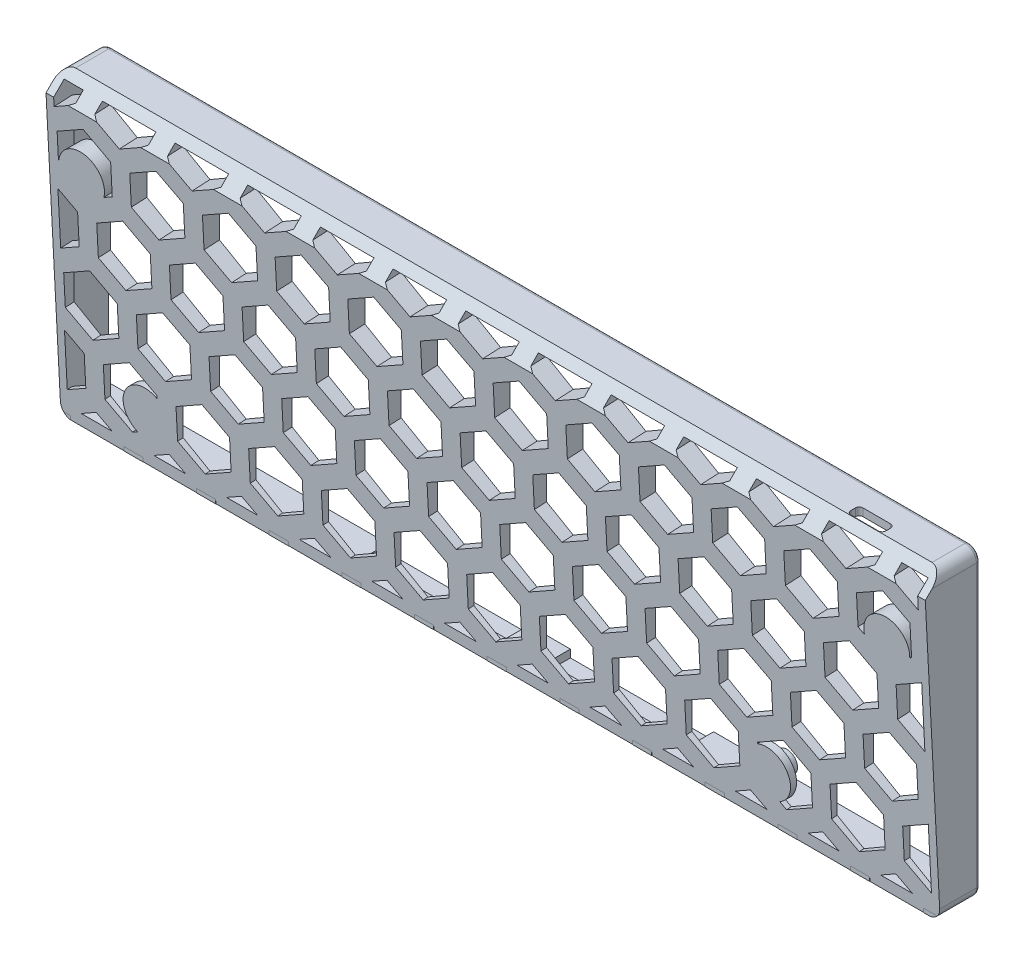
from build123d import *

# Parameters (mm, degrees)
EXTRUDE_START               = -317.833629667
EXTRUDE_5_DEPTH             = 229.901447803
SKETCH_8_R                  = 2.75
SKETCH_8_R_2                = 2.1
EXTRUDE_6_DEPTH             = 3.5
SKETCH_9_W                  = 229.901447803
SKETCH_9_H                  = 78.517145035
SKETCH_9_W_2                = 225.901447803
SKETCH_9_H_2                = 74.517145035
EXTRUDE_7_DEPTH             = 9.5
CUT_EXTRUDE_1_REACH         = 329.028
SKETCH_10_W                 = 9.2
SKETCH_10_H                 = 3.2
CUT_EXTRUDE_2_REACH         = 329.502
SKETCH_11_W                 = 37.443098272
SKETCH_11_H                 = 6
SKETCH_11_W_2               = 36.905977084
SKETCH_16_W                 = 229.901447803
SKETCH_16_H                 = 10.501372346
EXTRUDE_11_DEPTH            = 1
FILLET_3_R                  = 1
CUT_EXTRUDE_4_REACH         = 361.437
PATTERN_LINEAR_4_COUNT      = 7
PATTERN_LINEAR_4_PITCH      = 38
PATTERN_LINEAR_4_COUNT_DIR2 = 3
PATTERN_LINEAR_4_PITCH_DIR2 = 33
EXTRUDE_10_REACH            = 361.371
SKETCH_15_W                 = 229.901447803
SKETCH_15_H                 = 79.517145035
SKETCH_15_W_2               = 225.901447803
SKETCH_15_H_2               = 74.517145035
SKETCH_15_R                 = 6
CHAMFER_1_SIZE              = 5
CHAMFER_1_SIZE_2            = 4.75753014
FILLET_4_R                  = 3
FILLET_5_R                  = 1


with BuildPart() as part:
    # 凸台-拉伸5: read off the stored shape, not the designer's step
    # 凸台-拉伸5 outline → 凸台-拉伸5 (new body)
    with BuildSketch(Plane.YZ.offset(EXTRUDE_START)):
        Polygon((-87.932181864, 3.5), (-87.932181864, 8.616281553), (-166.449326899, 4.501372346), (-166.449326899, 3.5), align=None)
    extrude(amount=EXTRUDE_5_DEPTH)

    # 草图8 → 凸台-拉伸6 (add)
    # profile 1 of 4: a face of its own
    with BuildSketch(Plane(origin=(0, 0, 3.5), x_dir=(-1, 0, 0), z_dir=(0, 0, -1))):
        with Locations(Location((294.960589921, -155.576311153, 0), (0, 0, 180))):
            Circle(SKETCH_8_R)
        with Locations(Location((294.960589921, -155.576311153, 0), (0, 0, 180))):
            Circle(SKETCH_8_R_2, mode=Mode.SUBTRACT)
    # profile 2 of 4: a face of its own
    with BuildSketch(Plane(origin=(0, 0, 3.5), x_dir=(-1, 0, 0), z_dir=(0, 0, -1))):
        with Locations(Location((309.346617473, -108.059216118, 0), (0, 0, 180))):
            Circle(SKETCH_8_R)
        with Locations(Location((309.346617473, -108.059216118, 0), (0, 0, 180))):
            Circle(SKETCH_8_R_2, mode=Mode.SUBTRACT)
    # profile 3 of 4: a face of its own
    with BuildSketch(Plane(origin=(0, 0, 3.5), x_dir=(-1, 0, 0), z_dir=(0, 0, -1))):
        with Locations(Location((132.460264921, -155.576311153, 0), (0, 0, 180))):
            Circle(SKETCH_8_R)
        with Locations(Location((132.460264921, -155.576311153, 0), (0, 0, 180))):
            Circle(SKETCH_8_R_2, mode=Mode.SUBTRACT)
    # profile 4 of 4: a face of its own
    with BuildSketch(Plane(origin=(0, 0, 3.5), x_dir=(-1, 0, 0), z_dir=(0, 0, -1))):
        with Locations(Location((98.80519761, -108.059216118, 0), (0, 0, 180))):
            Circle(SKETCH_8_R)
        with Locations(Location((98.80519761, -108.059216118, 0), (0, 0, 180))):
            Circle(SKETCH_8_R_2, mode=Mode.SUBTRACT)
    extrude(amount=EXTRUDE_6_DEPTH)

    # 草图9 → 凸台-拉伸7 (add)
    with BuildSketch(Plane(origin=(0, 0, 3.5), x_dir=(-1, 0, 0), z_dir=(0, 0, -1))):
        with Locations((202.882905766, -127.190754381)):
            Rectangle(SKETCH_9_W, SKETCH_9_H)
        with Locations((202.882905766, -127.190754381)):
            Rectangle(SKETCH_9_W_2, SKETCH_9_H_2, mode=Mode.SUBTRACT)
    extrude(amount=EXTRUDE_7_DEPTH)

    # 草图10 → 切除-拉伸1 (cut, up to next)
    with BuildSketch(Plane.XZ.offset(89.932181864), mode=Mode.PRIVATE) as cut_extrude_1_sk1:
        with Locations((-108.685213353, 1.9)):
            Rectangle(SKETCH_10_W, SKETCH_10_H)
    cut_extrude_1_tool1 = extrude(cut_extrude_1_sk1.sketch, amount=-CUT_EXTRUDE_1_REACH, mode=Mode.PRIVATE) & part.part
    add(cut_extrude_1_tool1.solids().sort_by_distance((-108.685213, -89.932182, 1.9))[0], mode=Mode.SUBTRACT)

    # 草图11 → 切除-拉伸2 (cut, up to next)
    with BuildSketch(Plane.XZ.offset(166.449326899), mode=Mode.PRIVATE) as cut_extrude_2_sk1:
        with Locations((-176.363119296, -3)):
            Rectangle(SKETCH_11_W, SKETCH_11_H)
    cut_extrude_2_tool1 = extrude(cut_extrude_2_sk1.sketch, amount=-CUT_EXTRUDE_2_REACH, mode=Mode.PRIVATE) & part.part
    # 草图11 → 切除-拉伸2 (cut, up to next)
    with BuildSketch(Plane.XZ.offset(166.449326899), mode=Mode.PRIVATE) as cut_extrude_2_sk2:
        with Locations((-224.366433798, -3)):
            Rectangle(SKETCH_11_W_2, SKETCH_11_H)
    cut_extrude_2_tool2 = extrude(cut_extrude_2_sk2.sketch, amount=-CUT_EXTRUDE_2_REACH, mode=Mode.PRIVATE) & part.part
    add(cut_extrude_2_tool1.solids().sort_by_distance((-176.363119, -166.449327, -3))[0], mode=Mode.SUBTRACT)
    add(cut_extrude_2_tool2.solids().sort_by_distance((-224.366434, -166.449327, -3))[0], mode=Mode.SUBTRACT)

    # 草图16 → 凸台-拉伸11 (add)
    with BuildSketch(Plane.XZ.offset(166.449326899)):
        with Locations((-202.882905766, -0.749313827)):
            Rectangle(SKETCH_16_W, SKETCH_16_H)
    extrude(amount=EXTRUDE_11_DEPTH)

    # 圆角3
    fillet_3_edges = [part.edges().sort_by_distance(p)[0] for p in [
        (-104.085213353, -88.932181864, 3.5),
        (-104.085213353, -88.932181864, 0.3),
        (-113.285213353, -88.932181864, 0.3),
        (-113.285213353, -88.932181864, 3.5),
    ]]
    fillet(fillet_3_edges, radius=FILLET_3_R)

    # 切除-拉伸4: up to this plane
    cut_extrude_4_end = Plane(origin=(0, 0, 3.5), z_dir=(0, 0, 1))
    # 草图14 → 切除-拉伸4 (cut, up to the surface)
    with BuildSketch(Plane(origin=(0, -0.691174181, 13.188389028), x_dir=(1, 0, 0), z_dir=(0, -0.05233595624293018, 0.9986295347545746)), mode=Mode.PRIVATE) as cut_extrude_4_sk1:
        Polygon((-317.833629667, -95.443636299), (-310.833629667, -91.402184415), (-310.833629667, -83.319280647), (-317.833629667, -79.277828762), (-324.833629667, -83.319280647), (-324.833629667, -91.402184415), align=None)
    cut_extrude_4_tool1 = split(extrude(cut_extrude_4_sk1.sketch, amount=-CUT_EXTRUDE_4_REACH, mode=Mode.PRIVATE), bisect_by=cut_extrude_4_end, keep=Keep.BOTH, mode=Mode.PRIVATE)
    # 草图14 → 切除-拉伸4 (cut, up to the surface)
    with BuildSketch(Plane(origin=(0, -0.691174181, 13.188389028), x_dir=(1, 0, 0), z_dir=(0, -0.05233595624293018, 0.9986295347545746)), mode=Mode.PRIVATE) as cut_extrude_4_sk2:
        Polygon((-308.333629667, -95.732311434), (-315.333629667, -99.773763318), (-315.333629667, -107.856667087), (-308.333629667, -111.898118971), (-301.333629667, -107.856667087), (-301.333629667, -99.773763318), align=None)
    cut_extrude_4_tool2 = split(extrude(cut_extrude_4_sk2.sketch, amount=-CUT_EXTRUDE_4_REACH, mode=Mode.PRIVATE), bisect_by=cut_extrude_4_end, keep=Keep.BOTH, mode=Mode.PRIVATE)
    # 草图14 → 切除-拉伸4 (cut, up to the surface)
    with BuildSketch(Plane(origin=(0, -0.691174181, 13.188389028), x_dir=(1, 0, 0), z_dir=(0, -0.05233595624293018, 0.9986295347545746)), mode=Mode.PRIVATE) as cut_extrude_4_sk3:
        Polygon((-298.833629667, -95.443636299), (-291.833629667, -91.402184415), (-291.833629667, -83.319280647), (-298.833629667, -79.277828762), (-305.833629667, -83.319280647), (-305.833629667, -91.402184415), align=None)
    cut_extrude_4_tool3 = split(extrude(cut_extrude_4_sk3.sketch, amount=-CUT_EXTRUDE_4_REACH, mode=Mode.PRIVATE), bisect_by=cut_extrude_4_end, keep=Keep.BOTH, mode=Mode.PRIVATE)
    # 草图14 → 切除-拉伸4 (cut, up to the surface)
    with BuildSketch(Plane(origin=(0, -0.691174181, 13.188389028), x_dir=(1, 0, 0), z_dir=(0, -0.05233595624293018, 0.9986295347545746)), mode=Mode.PRIVATE) as cut_extrude_4_sk4:
        Polygon((-289.333629667, -111.746060859), (-282.333629667, -107.704608975), (-282.333629667, -99.621705206), (-289.267786573, -95.694296906), (-296.333629667, -99.773763318), (-296.333629667, -107.704608975), align=None)
    cut_extrude_4_tool4 = split(extrude(cut_extrude_4_sk4.sketch, amount=-CUT_EXTRUDE_4_REACH, mode=Mode.PRIVATE), bisect_by=cut_extrude_4_end, keep=Keep.BOTH, mode=Mode.PRIVATE)
    cut_extrude_4 = cut_extrude_4_tool1.solids().sort_by_distance((-317.83363, -87.932182, 8.616282))[0] + cut_extrude_4_tool2.solids().sort_by_distance((-308.33363, -104.364114, 7.75512))[0] + cut_extrude_4_tool3.solids().sort_by_distance((-298.83363, -87.932182, 8.616282))[0] + cut_extrude_4_tool4.solids().sort_by_distance((-289.31523, -104.260854, 7.760532))[0]
    add(cut_extrude_4, mode=Mode.SUBTRACT)


with BuildPart() as cut_extrude_4_piece_1:
    # of the separate pieces the step leaves, piece 1, a body of its own (cut_extrude_4_pieces)
    add(part.part.solids().sort_by_distance((-310.833629667, -87.932181864, 8.616281553))[0])

    # 阵列(线性)4: Cut-Extrude 4 7 × 3
    with Locations(*[(i * PATTERN_LINEAR_4_PITCH, -j * PATTERN_LINEAR_4_PITCH_DIR2, 0) for i in range(PATTERN_LINEAR_4_COUNT) for j in range(PATTERN_LINEAR_4_COUNT_DIR2) if (i, j) != (0, 0)]):
        add(cut_extrude_4, mode=Mode.SUBTRACT)



with BuildPart() as cut_extrude_4_piece_2:
    # of the separate pieces the step leaves, piece 2, a body of its own (cut_extrude_4_pieces)
    add(part.part.solids().sort_by_distance((-306.596617473, -108.059216118, 3.5))[0])


with BuildPart() as cut_extrude_4_piece_1_1:
    add(cut_extrude_4_piece_1.part)

    add(cut_extrude_4_piece_2.part)  # 凸台-拉伸10 merges 切除-拉伸4 piece 2
    # 凸台-拉伸10: up to this plane
    extrude_10_end = Plane(origin=(0, -0.691174181, 13.188389028), z_dir=(0, -0.05233595624293018, 0.9986295347545746))
    # 草图15 → 凸台-拉伸10 (add, up to the surface)
    with BuildSketch(Plane.XY.offset(3.5), mode=Mode.PRIVATE) as extrude_10_sk1:
        with Locations((-202.882905766, -127.690754381)):
            Rectangle(SKETCH_15_W, SKETCH_15_H)
        with Locations((-202.882905766, -127.190754381)):
            Rectangle(SKETCH_15_W_2, SKETCH_15_H_2, mode=Mode.SUBTRACT)
    extrude_10_tool1 = split(extrude(extrude_10_sk1.sketch, amount=EXTRUDE_10_REACH, mode=Mode.PRIVATE), bisect_by=extrude_10_end, keep=Keep.BOTH, mode=Mode.PRIVATE)
    add(extrude_10_tool1.solids().sort_by_distance((-202.882906, -88.175446, 3.5))[0])
    # 草图15 → 凸台-拉伸10 (add, up to the surface)
    with BuildSketch(Plane.XY.offset(3.5), mode=Mode.PRIVATE) as extrude_10_sk2:
        with Locations((-98.80519761, -108.059216118)):
            Circle(SKETCH_15_R)
    extrude_10_tool2 = split(extrude(extrude_10_sk2.sketch, amount=EXTRUDE_10_REACH, mode=Mode.PRIVATE), bisect_by=extrude_10_end, keep=Keep.BOTH, mode=Mode.PRIVATE)
    add(extrude_10_tool2.solids().sort_by_distance((-98.805198, -108.059216, 3.5))[0])
    # 草图15 → 凸台-拉伸10 (add, up to the surface)
    with BuildSketch(Plane.XY.offset(3.5), mode=Mode.PRIVATE) as extrude_10_sk3:
        with Locations((-132.460264921, -155.576311153)):
            Circle(SKETCH_15_R)
    extrude_10_tool3 = split(extrude(extrude_10_sk3.sketch, amount=EXTRUDE_10_REACH, mode=Mode.PRIVATE), bisect_by=extrude_10_end, keep=Keep.BOTH, mode=Mode.PRIVATE)
    add(extrude_10_tool3.solids().sort_by_distance((-132.460265, -155.576311, 3.5))[0])
    # 草图15 → 凸台-拉伸10 (add, up to the surface)
    with BuildSketch(Plane.XY.offset(3.5), mode=Mode.PRIVATE) as extrude_10_sk4:
        with Locations((-294.960589921, -155.576311153)):
            Circle(SKETCH_15_R)
    extrude_10_tool4 = split(extrude(extrude_10_sk4.sketch, amount=EXTRUDE_10_REACH, mode=Mode.PRIVATE), bisect_by=extrude_10_end, keep=Keep.BOTH, mode=Mode.PRIVATE)
    add(extrude_10_tool4.solids().sort_by_distance((-294.96059, -155.576311, 3.5))[0])
    # 草图15 → 凸台-拉伸10 (add, up to the surface)
    with BuildSketch(Plane.XY.offset(3.5), mode=Mode.PRIVATE) as extrude_10_sk5:
        with Locations((-309.346617473, -108.059216118)):
            Circle(SKETCH_15_R)
    extrude_10_tool5 = split(extrude(extrude_10_sk5.sketch, amount=EXTRUDE_10_REACH, mode=Mode.PRIVATE), bisect_by=extrude_10_end, keep=Keep.BOTH, mode=Mode.PRIVATE)
    add(extrude_10_tool5.solids().sort_by_distance((-309.346617, -108.059216, 3.5))[0])

    # 倒角1
    # the kernel refuses this chamfer: 5, 4.75753014 mm, written as the material it takes off along each edge
    with BuildSketch(Plane(origin=(-196.833629667, -87.932181864, 8.616281553), x_dir=(0, 7.200640084192855e-11, -1.0), z_dir=(-1, 0, 0)), Plane(origin=(-215.833629667, -87.932181864, 8.616281553), x_dir=(0, 7.200640084192855e-11, -1.0), z_dir=(-1, 0, 0)), Plane(origin=(-234.833629667, -87.932181864, 8.616281553), x_dir=(0, 7.200640084192855e-11, -1.0), z_dir=(-1, 0, 0)), Plane(origin=(-253.833629667, -87.932181864, 8.616281553), x_dir=(0, 7.200640084192855e-11, -1.0), z_dir=(-1, 0, 0)), Plane(origin=(-272.833629667, -87.932181864, 8.616281553), x_dir=(0, 7.200640084192855e-11, -1.0), z_dir=(-1, 0, 0)), Plane(origin=(-177.833629667, -87.932181864, 8.616281553), x_dir=(0, 7.200640084192855e-11, -1.0), z_dir=(-1, 0, 0)), Plane(origin=(-158.833629667, -87.932181864, 8.616281553), x_dir=(0, 7.200640084192855e-11, -1.0), z_dir=(-1, 0, 0)), Plane(origin=(-139.833629667, -87.932181864, 8.616281553), x_dir=(0, 7.200640084192855e-11, -1.0), z_dir=(-1, 0, 0)), Plane(origin=(-120.833629667, -87.932181864, 8.616281553), x_dir=(0, 7.200640084192855e-11, -1.0), z_dir=(-1, 0, 0)), Plane(origin=(-101.833629667, -87.932181864, 8.616281553), x_dir=(0, 7.200640084192855e-11, -1.0), z_dir=(-1, 0, 0))) as chamfer_1_piece_1:
        Polygon((CHAMFER_1_SIZE, 0), (CHAMFER_1_SIZE_2 * 0.0523359561569, CHAMFER_1_SIZE_2 * 0.998629534854), (0, 0), align=None)
    extrude(amount=14, mode=Mode.SUBTRACT)
    with BuildSketch(Plane(origin=(-196.833629667, -87.932181864, 8.616281553), x_dir=(0, 0, -1), z_dir=(1, 0, 0)), Plane(origin=(-215.833629667, -87.932181864, 8.616281553), x_dir=(0, 0, -1), z_dir=(1, 0, 0)), Plane(origin=(-234.833629667, -87.932181864, 8.616281553), x_dir=(0, 0, -1), z_dir=(1, 0, 0)), Plane(origin=(-253.833629667, -87.932181864, 8.616281553), x_dir=(0, 0, -1), z_dir=(1, 0, 0)), Plane(origin=(-272.833629667, -87.932181864, 8.616281553), x_dir=(0, 0, -1), z_dir=(1, 0, 0)), Plane(origin=(-177.833629667, -87.932181864, 8.616281553), x_dir=(0, 0, -1), z_dir=(1, 0, 0)), Plane(origin=(-158.833629667, -87.932181864, 8.616281553), x_dir=(0, 0, -1), z_dir=(1, 0, 0)), Plane(origin=(-139.833629667, -87.932181864, 8.616281553), x_dir=(0, 0, -1), z_dir=(1, 0, 0)), Plane(origin=(-120.833629667, -87.932181864, 8.616281553), x_dir=(0, 0, -1), z_dir=(1, 0, 0)), Plane(origin=(-101.833629667, -87.932181864, 8.616281553), x_dir=(0, 0, -1), z_dir=(1, 0, 0))) as chamfer_1_piece_2:
        Polygon((CHAMFER_1_SIZE, 0), (CHAMFER_1_SIZE_2 * 0.0523359562488, -CHAMFER_1_SIZE_2 * 0.998629534849), (0, 0), align=None)
    extrude(amount=5, mode=Mode.SUBTRACT)
    with BuildSketch(Plane(origin=(-310.833629667, -87.932181864, 8.616281553), x_dir=(0, 0, -1), z_dir=(1, 0, 0))) as chamfer_1_piece_3:
        Polygon((CHAMFER_1_SIZE, 0), (CHAMFER_1_SIZE_2 * 0.0523359562393, -CHAMFER_1_SIZE_2 * 0.99862953485), (0, 0), align=None)
    extrude(amount=24, mode=Mode.SUBTRACT)
    with BuildSketch(Plane(origin=(-310.833629667, -87.932181864, 8.616281553), x_dir=(0, 7.200640084192855e-11, -1.0), z_dir=(-1, 0, 0))) as chamfer_1_piece_4:
        Polygon((CHAMFER_1_SIZE, 0), (CHAMFER_1_SIZE_2 * 0.0523359561569, CHAMFER_1_SIZE_2 * 0.998629534854), (0, 0), align=None)
    extrude(amount=19.85841494, mode=Mode.SUBTRACT)
    with BuildSketch(Plane(origin=(-75.073766925, -87.932181864, 8.616281553), x_dir=(0, 7.200640084192855e-11, -1.0), z_dir=(-1, 0, 0))) as chamfer_1_piece_5:
        Polygon((CHAMFER_1_SIZE, 0), (CHAMFER_1_SIZE_2 * 0.0523359561569, CHAMFER_1_SIZE_2 * 0.998629534854), (0, 0), align=None)
    extrude(amount=21.759862743, mode=Mode.SUBTRACT)

    # 圆角4
    # the kernel refuses this fillet: 3 mm, written as the material it takes off along each edge
    with BuildSketch(Plane(origin=(-87.932181864, -87.932181864, 11.116281552), x_dir=(-1.0, 1.2001066808444095e-10, 0), z_dir=(0, 0, -1))) as fillet_4_piece_1:
        with BuildLine():
            CenterArc((FILLET_4_R, -FILLET_4_R), FILLET_4_R, 89.999999993, 90)
            Line((-FILLET_4_R * 2.41333471725e-10, -FILLET_4_R), (0, 0))
            Line((0, 0), (FILLET_4_R, 0))
        make_face()
    extrude(amount=24.616281551, mode=Mode.SUBTRACT)
    with BuildSketch(Plane(origin=(-317.833629667, -87.932181864, -13.500000001), x_dir=(1.0, 1.200106680598824e-10, 0), z_dir=(0, 0, 1))) as fillet_4_piece_2:
        with BuildLine():
            CenterArc((FILLET_4_R, -FILLET_4_R), FILLET_4_R, 89.999999993, 90)
            Line((-FILLET_4_R * 3.66971638018e-11, -FILLET_4_R), (0, 0))
            Line((0, 0), (FILLET_4_R, 0))
        make_face()
    extrude(amount=24.616281554, mode=Mode.SUBTRACT)
    with BuildSketch(Plane(origin=(-317.833629667, -167.449326899, -13.500000001), x_dir=(8.331350424365762e-11, 1.0, 0), z_dir=(0, 0, 1))) as fillet_4_piece_3:
        with BuildLine():
            CenterArc((FILLET_4_R, -FILLET_4_R), FILLET_4_R, 90.000000005, 90)
            Line((FILLET_4_R * 8.33135042506e-11, -FILLET_4_R), (0, 0))
            Line((0, 0), (FILLET_4_R, 0))
        make_face()
    extrude(amount=25.501372347, mode=Mode.SUBTRACT)
    with BuildSketch(Plane(origin=(-87.932181864, -167.449326899, 12.001372346), x_dir=(1.2132280365525125e-10, 1.0, 0), z_dir=(0, 0, -1))) as fillet_4_piece_4:
        with BuildLine():
            CenterArc((FILLET_4_R, -FILLET_4_R), FILLET_4_R, 89.999999993, 90)
            Line((-FILLET_4_R * 1.21322803641e-10, -FILLET_4_R), (0, 0))
            Line((0, 0), (FILLET_4_R, 0))
        make_face()
    extrude(amount=25.501372346, mode=Mode.SUBTRACT)

    # 圆角5
    fillet_5_edges = [cut_extrude_4_piece_1_1.edges().sort_by_distance(p)[0] for p in [
        (-202.882905766, -87.932181864, -6),
        (-87.932181864, -127.690754381, -6),
        (-202.882905766, -167.449326899, -6),
        (-317.833629667, -127.690754381, -6),
        (-88.81086152, -166.570647242, -6),
        (-316.954950011, -166.570647242, -6),
        (-316.95495001, -88.81086152, -6),
        (-88.810861521, -88.81086152, -6),
    ]]
    fillet(fillet_5_edges, radius=FILLET_5_R - 0.0001)  # a hair under: the kernel refuses the full size


solid = cut_extrude_4_piece_1_1.part
